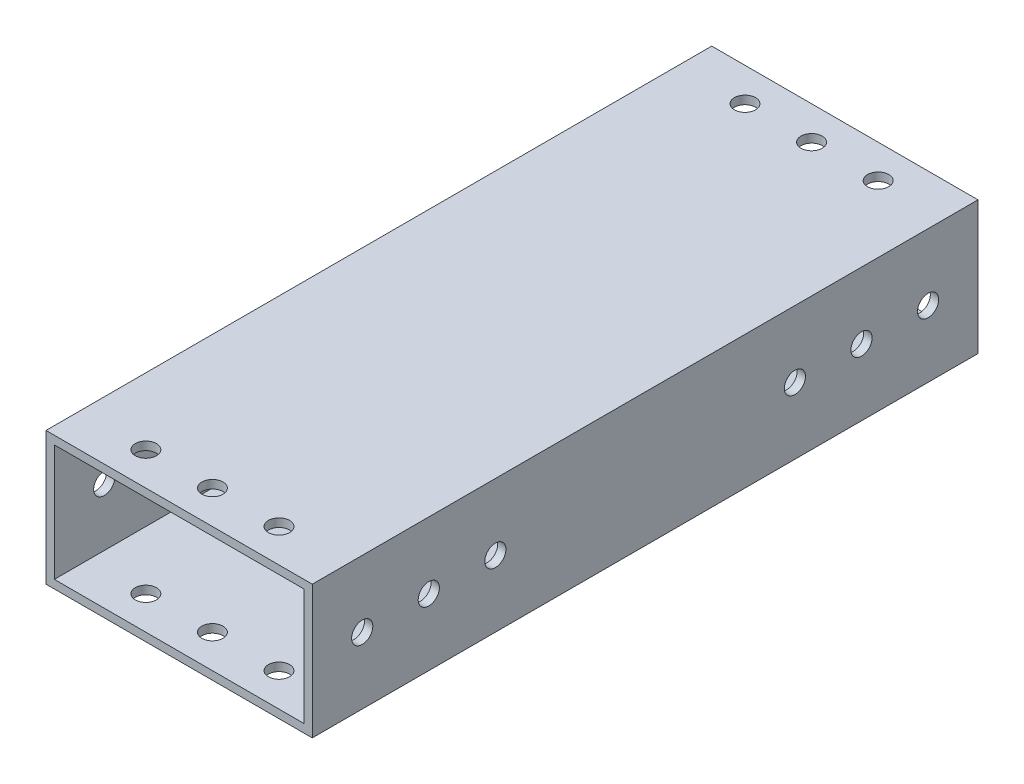
from build123d import *

# Parameters (mm, degrees)
SKETCH1_W           = 50.8
SKETCH1_H           = 25.4
SKETCH1_W_2         = 47.625
SKETCH1_H_2         = 22.225
BOSS_EXTRUDE1_DEPTH = 63.5
SKETCH2_R           = 2.0193
CUT_EXTRUDE1_DEPTH  = 73.955945611
SKETCH3_R           = 2.0193
CUT_EXTRUDE2_DEPTH  = 83.30540687


with BuildPart() as part:
    # Sketch1 → Boss-Extrude1 (new, symmetric)
    with BuildSketch(Plane.XY):
        Rectangle(SKETCH1_W, SKETCH1_H)
        Rectangle(SKETCH1_W_2, SKETCH1_H_2, mode=Mode.SUBTRACT)
    extrude(amount=BOSS_EXTRUDE1_DEPTH, both=True)

    # Sketch2 → Cut-Extrude1 (cut, through all)
    with BuildSketch(Plane(origin=(0, 12.7, 0), x_dir=(1, 0, 0), z_dir=(0, 1, 0))):
        with Locations((-12.7, 57.15)):
            Circle(SKETCH2_R)
        with Locations((0, 57.15)):
            Circle(SKETCH2_R)
        with Locations((12.7, 57.15)):
            Circle(SKETCH2_R)
        with Locations((12.7, -57.15)):
            Circle(SKETCH2_R)
        with Locations((0, -57.15)):
            Circle(SKETCH2_R)
        with Locations((-12.7, -57.15)):
            Circle(SKETCH2_R)
    extrude(amount=-CUT_EXTRUDE1_DEPTH, mode=Mode.SUBTRACT)

    # Sketch3 → Cut-Extrude2 (cut, through all)
    with BuildSketch(Plane.ZY.offset(25.4)):
        with Locations((-53.975, 0)):
            Circle(SKETCH3_R)
        with Locations((53.975, 0)):
            Circle(SKETCH3_R)
        with Locations((-41.275, 0)):
            Circle(SKETCH3_R)
        with Locations((-28.575, 0)):
            Circle(SKETCH3_R)
        with Locations((28.575, 0)):
            Circle(SKETCH3_R)
        with Locations((41.275, 0)):
            Circle(SKETCH3_R)
    extrude(amount=-CUT_EXTRUDE2_DEPTH, mode=Mode.SUBTRACT)


solid = part.part
